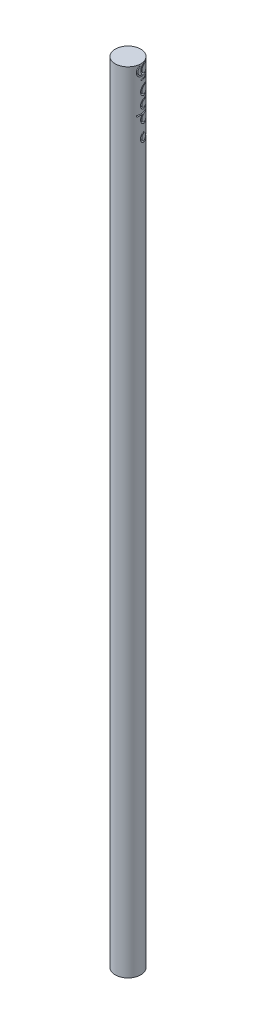
from build123d import *
from build123d.topology import SkipClean

# Parameters (mm, degrees)
SKETCH1_R           = 1
BOSS_EXTRUDE1_DEPTH = 61.8
CUT_EXTRUDE1_DEPTH  = 1


with BuildPart() as part:
    # Sketch1 → Boss-Extrude1 (new body)
    with BuildSketch(Plane(origin=(0, 0, 0), x_dir=(1, 0, 0), z_dir=(0, 1, 0))):
        Circle(SKETCH1_R)
    extrude(amount=BOSS_EXTRUDE1_DEPTH)

    # Sketch2 → Cut-Extrude1 (cut)
    # profile 1 of 6: a face of its own
    with SkipClean():  # the faces are left unmerged after this step: merging them gives an invalid solid
        with BuildSketch(Plane(origin=(1, 0, 0), x_dir=(0, 0, -1), z_dir=(1, 0, 0))):
            with BuildLine():
                Line((0.773397436, 61.013034188), (0.773397436, 60.918055556))
                Line((0.773397436, 60.918055556), (0.159640425, 60.918055556))
                add(Edge.make_bspline(
                    [(0.159640425, 60.918055556), (0.1465662, 60.918139328), (0.121329796, 60.918301029), (0.084838983, 60.919465489), (0.051133762, 60.921921027), (0.020060412, 60.924705557), (-0.008237035, 60.928711112), (-0.033843019, 60.933602537), (-0.05678211, 60.939116659), (-0.070910812, 60.943960868), (-0.077594151, 60.946252337)],
                    knots=[0, 0, 0, 0, 1.307562039, 2.523909702, 3.650326591, 4.686913197, 5.643429486, 6.506965704, 7.293745905, 8, 8, 8, 8], degree=3))
                add(Edge.make_bspline(
                    [(-0.077594151, 60.946252337), (-0.086281834, 60.949635422), (-0.103397445, 60.95630044), (-0.127654434, 60.968789133), (-0.150514313, 60.982751952), (-0.171715879, 60.998755843), (-0.191592708, 61.016395929), (-0.209797708, 61.035996131), (-0.226613422, 61.057207943), (-0.241707156, 61.080203982), (-0.254933259, 61.104751286), (-0.266639825, 61.130523377), (-0.276750372, 61.157445753), (-0.284339135, 61.185777371), (-0.290910135, 61.215087879), (-0.295187544, 61.245718111), (-0.298098493, 61.277490173), (-0.298367695, 61.299093889), (-0.298504274, 61.31005442)],
                    knots=[0, 0, 0, 0, 0.981884813, 1.934411902, 2.870642727, 3.801527012, 4.729816098, 5.667674509, 6.616731011, 7.579249157, 8.562291171, 9.552107921, 10.560574871, 11.588648803, 12.640348669, 13.724070705, 14.845319185, 16, 16, 16, 16], degree=3))
                add(Edge.make_bspline(
                    [(-0.298504274, 61.31005442), (-0.298245863, 61.326045916), (-0.297741117, 61.357281603), (-0.291839431, 61.402819467), (-0.283548887, 61.446011998), (-0.270868408, 61.486312593), (-0.255415135, 61.523565511), (-0.237814156, 61.557603578), (-0.21742875, 61.587866964), (-0.194305039, 61.61512324), (-0.166796954, 61.639718107), (-0.134382791, 61.662858889), (-0.096564724, 61.685132436), (-0.068808389, 61.698185828), (-0.054273504, 61.705021368)],
                    knots=[0, 0, 0, 0, 1.157931887, 2.261752077, 3.322178827, 4.340878186, 5.316509817, 6.24181319, 7.112369066, 7.954886437, 8.824930176, 9.778504873, 10.836691706, 12, 12, 12, 12], degree=3))
                Line((-0.054273504, 61.705021368), (-0.054273504, 61.610042735))
                add(Edge.make_bspline(
                    [(-0.054273504, 61.610042735), (-0.066400757, 61.602403924), (-0.090108043, 61.587470989), (-0.120803688, 61.559546568), (-0.147036253, 61.528943702), (-0.16817594, 61.494629608), (-0.184114376, 61.456461507), (-0.19547643, 61.414416438), (-0.202278873, 61.368152266), (-0.203098717, 61.335943187), (-0.203525641, 61.319170673)],
                    knots=[0, 0, 0, 0, 0.997731894, 1.950442991, 2.880492273, 3.800895997, 4.748200782, 5.754801363, 6.83083817, 8, 8, 8, 8], degree=3))
                add(Edge.make_bspline(
                    [(-0.203525641, 61.319170673), (-0.203095157, 61.302609777), (-0.202265228, 61.270682028), (-0.195442828, 61.224709357), (-0.184142908, 61.182717427), (-0.168262978, 61.145021644), (-0.148650157, 61.11219146), (-0.126950924, 61.083791421), (-0.102394777, 61.060771856), (-0.079784142, 61.045284855), (-0.059638006, 61.035658834), (-0.042295735, 61.029528859), (-0.022685441, 61.024547456), (-0.000872974, 61.020380692), (0.023172862, 61.016942345), (0.049507038, 61.014764331), (0.078069708, 61.013190192), (0.097873585, 61.013087392), (0.108122997, 61.013034188)],
                    knots=[0, 0, 0, 0, 1.570672572, 3.028099501, 4.397683431, 5.686589315, 6.895122698, 8.017723291, 9.066023084, 10.075791025, 10.603605416, 11.180458235, 11.81795017, 12.521450677, 13.286658401, 14.121327423, 15.027701111, 16, 16, 16, 16], degree=3))
                Line((0.108122997, 61.013034188), (0.148192107, 61.013034188))
                add(Edge.make_bspline(
                    [(0.148192107, 61.013034188), (0.136719229, 61.022674431), (0.113975277, 61.041785347), (0.084172115, 61.07478942), (0.058504166, 61.110838344), (0.037452817, 61.149870749), (0.020615815, 61.190930527), (0.008840206, 61.233572963), (0.001232331, 61.277415799), (0.00041369, 61.307125377), (0, 61.322138755)],
                    knots=[0, 0, 0, 0, 1.012485704, 2.007162095, 2.997754123, 3.998611389, 4.999708251, 5.992315798, 6.98544096, 8, 8, 8, 8], degree=3))
                add(Edge.make_bspline(
                    [(0, 61.322138755), (0.000155734, 61.330979246), (0.00046536, 61.34855561), (0.003174323, 61.374667641), (0.007104895, 61.400394345), (0.012874759, 61.425675722), (0.020280591, 61.450548253), (0.02953851, 61.474970833), (0.04000546, 61.499141212), (0.052334385, 61.522620024), (0.066051061, 61.545173485), (0.080909804, 61.566631271), (0.096832381, 61.586881753), (0.113977513, 61.605729384), (0.132314096, 61.623159773), (0.151669946, 61.639368944), (0.172197325, 61.654210359), (0.193904221, 61.667491671), (0.216261397, 61.679625464), (0.239375941, 61.690014192), (0.263101622, 61.698638172), (0.287141833, 61.706238551), (0.311934957, 61.711620557), (0.337187142, 61.715735954), (0.36305245, 61.718044958), (0.380475703, 61.718407379), (0.389242788, 61.718589744)],
                    knots=[0, 0, 0, 0, 1.028796061, 2.045417375, 3.052978994, 4.056772505, 5.061374657, 6.071351207, 7.095367434, 8.125609542, 9.155490328, 10.16637099, 11.162041966, 12.151987513, 13.129482149, 14.104793677, 15.088808581, 16.075021637, 17.065069715, 18.0481558, 19.021557435, 20.00254184, 20.980451754, 21.971763498, 22.979425854, 24, 24, 24, 24], degree=3))
                add(Edge.make_bspline(
                    [(0.389242788, 61.718589744), (0.398012814, 61.718432867), (0.415518898, 61.718119723), (0.441486565, 61.715411487), (0.467109459, 61.711556716), (0.492109575, 61.705423653), (0.516847826, 61.698146354), (0.540921458, 61.688707997), (0.564649062, 61.677833805), (0.587822563, 61.665405123), (0.610228762, 61.651492544), (0.631408757, 61.636178543), (0.65153872, 61.619783262), (0.670360465, 61.601976748), (0.68801507, 61.582864261), (0.704347612, 61.562390242), (0.719653306, 61.540782414), (0.733596229, 61.517966767), (0.745928075, 61.494297263), (0.757180437, 61.470374728), (0.766110997, 61.445882411), (0.773979885, 61.421276903), (0.779554338, 61.396124882), (0.783854873, 61.370734741), (0.786474919, 61.345019558), (0.78680197, 61.327798088), (0.786965812, 61.319170673)],
                    knots=[0, 0, 0, 0, 1.008914434, 2.013921196, 3.001938835, 3.98818112, 4.973517748, 5.967241793, 6.960633033, 7.975722852, 8.991170928, 9.993245185, 10.981396684, 11.976616977, 12.972235889, 13.973022409, 14.988340224, 16.01763096, 17.047082309, 18.058647952, 19.057085865, 20.044802253, 21.029198803, 22.0185208, 23.007341325, 24, 24, 24, 24], degree=3))
                add(Edge.make_bspline(
                    [(0.786965812, 61.319170673), (0.786561972, 61.304942217), (0.785766497, 61.276915308), (0.779331072, 61.235587423), (0.769300753, 61.195664739), (0.754719793, 61.156942746), (0.734987726, 61.119185088), (0.708662772, 61.082619007), (0.676264918, 61.046618516), (0.651170392, 61.024514031), (0.638137687, 61.013034188)],
                    knots=[0, 0, 0, 0, 0.967343326, 1.905452219, 2.838102277, 3.762990896, 4.713322225, 5.726933809, 6.819495538, 8, 8, 8, 8], degree=3))
                Line((0.638137687, 61.013034188), (0.773397436, 61.013034188))
            make_face()
            with BuildLine():
                add(Edge.make_bspline(
                    [(0.691987179, 61.311538462), (0.691515147, 61.325427037), (0.690580623, 61.352923473), (0.682602328, 61.393227243), (0.670100344, 61.432137021), (0.652215875, 61.468906955), (0.63041916, 61.503354842), (0.603997404, 61.533901342), (0.573909274, 61.56066907), (0.540141325, 61.583031674), (0.503877185, 61.601000477), (0.465701711, 61.614064268), (0.426054771, 61.622227065), (0.399033751, 61.62314757), (0.385426683, 61.623611111)],
                    knots=[0, 0, 0, 0, 1.026331696, 2.03191913, 3.02692423, 4.041490544, 5.047661868, 6.033509946, 7.018359977, 8.017132933, 9.01989117, 10.003339456, 10.994534818, 12, 12, 12, 12], degree=3))
                add(Edge.make_bspline(
                    [(0.385426683, 61.623611111), (0.375165846, 61.623391756), (0.35498578, 61.622960349), (0.325372106, 61.618809173), (0.297162708, 61.612107274), (0.270374741, 61.602582508), (0.244751554, 61.590858007), (0.220766907, 61.57575644), (0.197980726, 61.558376074), (0.176861302, 61.53843981), (0.157597372, 61.516505482), (0.140759036, 61.492729695), (0.126797952, 61.46724266), (0.114910879, 61.440451628), (0.106166214, 61.411789399), (0.099505523, 61.381685762), (0.095691929, 61.349938796), (0.0952195, 61.328296793), (0.094978632, 61.31726262)],
                    knots=[0, 0, 0, 0, 1.039892369, 2.045164194, 3.025377528, 3.974939947, 4.923826224, 5.876304068, 6.842270891, 7.825700405, 8.815919897, 9.798017152, 10.773083594, 11.758208475, 12.764450271, 13.80592145, 14.881349344, 16, 16, 16, 16], degree=3))
                add(Edge.make_bspline(
                    [(0.094978632, 61.31726262), (0.095210743, 61.306085484), (0.095664632, 61.284228712), (0.099566405, 61.252306072), (0.105862572, 61.222058074), (0.114801873, 61.19351247), (0.126208194, 61.166561414), (0.140642902, 61.141507906), (0.157081433, 61.117813854), (0.176256908, 61.096239107), (0.197385494, 61.076720527), (0.220392199, 61.059745791), (0.244833019, 61.045167181), (0.271019563, 61.033564083), (0.298605793, 61.023992893), (0.328056868, 61.017958838), (0.358939321, 61.0136312), (0.380110189, 61.013236217), (0.390938835, 61.013034188)],
                    knots=[0, 0, 0, 0, 1.121992135, 2.194043731, 3.223932285, 4.220423016, 5.193184374, 6.156086365, 7.118779155, 8.084057622, 9.048292205, 10.002025119, 10.950065319, 11.899697616, 12.87359713, 13.875731462, 14.913461982, 16, 16, 16, 16], degree=3))
                add(Edge.make_bspline(
                    [(0.390938835, 61.013034188), (0.405035187, 61.013439248), (0.432574504, 61.014230592), (0.4727025, 61.021698543), (0.510430181, 61.033739413), (0.545638161, 61.05062642), (0.577953629, 61.071787599), (0.606777185, 61.097275721), (0.632149319, 61.12665017), (0.653277049, 61.159830591), (0.670410726, 61.195576867), (0.6830955, 61.232964772), (0.690448099, 61.271888872), (0.691470296, 61.298222574), (0.691987179, 61.311538462)],
                    knots=[0, 0, 0, 0, 1.070930318, 2.092221514, 3.091405799, 4.074392322, 5.052047932, 6.019043127, 6.99061078, 7.993717296, 9.000730765, 9.998165278, 10.987753177, 12, 12, 12, 12], degree=3))
            make_face(mode=Mode.SUBTRACT)
        # profile 2 of 6: a face of its own
        with BuildSketch(Plane(origin=(1, 0, 0), x_dir=(0, 0, -1), z_dir=(1, 0, 0))):
            with BuildLine():
                Line((0.773397436, 60.728098291), (0.773397436, 60.633119658))
                Line((0.773397436, 60.633119658), (0.65955028, 60.633119658))
                add(Edge.make_bspline(
                    [(0.65955028, 60.633119658), (0.670151604, 60.626108662), (0.690426554, 60.612700185), (0.717224072, 60.590399869), (0.739510637, 60.567564501), (0.757068629, 60.543910092), (0.770325711, 60.519634386), (0.780117681, 60.495141051), (0.785809509, 60.469922699), (0.786579861, 60.4529419), (0.786965812, 60.444434428)],
                    knots=[0, 0, 0, 0, 1.280622107, 2.44917983, 3.507334186, 4.490567186, 5.408878616, 6.288712897, 7.142636019, 8, 8, 8, 8], degree=3))
                add(Edge.make_bspline(
                    [(0.786965812, 60.444434428), (0.786613873, 60.437832425), (0.785893401, 60.424317135), (0.780578028, 60.403795714), (0.772413751, 60.382565181), (0.764548364, 60.368864694), (0.760465077, 60.361752137)],
                    knots=[0, 0, 0, 0, 0.90119973, 1.844890732, 2.881183062, 4, 4, 4, 4], degree=3))
                Line((0.760465077, 60.361752137), (0.678206798, 60.413905582))
                add(Edge.make_bspline(
                    [(0.678206798, 60.413905582), (0.680244926, 60.418474262), (0.684113683, 60.427146492), (0.688692338, 60.439832754), (0.691388341, 60.451529253), (0.691796773, 60.458980996), (0.691987179, 60.462454928)],
                    knots=[0, 0, 0, 0, 1.180555205, 2.24091978, 3.179933427, 4, 4, 4, 4], degree=3))
                add(Edge.make_bspline(
                    [(0.691987179, 60.462454928), (0.691497847, 60.470153251), (0.690508666, 60.485715345), (0.682177989, 60.508530063), (0.669284361, 60.530768933), (0.654475901, 60.548205719), (0.640469657, 60.561810195), (0.628171808, 60.571523849), (0.614391561, 60.580440275), (0.59935371, 60.588958004), (0.582804605, 60.596719122), (0.564908683, 60.603962523), (0.545645478, 60.610511761), (0.532225048, 60.614246238), (0.525350561, 60.616159188)],
                    knots=[0, 0, 0, 0, 1.135927944, 2.296268816, 3.551388088, 4.924624343, 5.663947748, 6.437790805, 7.238014523, 8.089896346, 8.992356783, 9.939655789, 10.944608424, 12, 12, 12, 12], degree=3))
                add(Edge.make_bspline(
                    [(0.525350561, 60.616159188), (0.51921913, 60.617590174), (0.505638476, 60.620759698), (0.482854517, 60.623841425), (0.455935459, 60.626886255), (0.42480637, 60.629032138), (0.389544988, 60.631021212), (0.350097595, 60.63214307), (0.306423701, 60.633081401), (0.275890979, 60.633106519), (0.259919204, 60.633119658)],
                    knots=[0, 0, 0, 0, 0.566838948, 1.255505196, 2.06880316, 3.007127437, 4.065329342, 5.249902469, 6.561414163, 8, 8, 8, 8], degree=3))
                Line((0.259919204, 60.633119658), (0, 60.633119658))
                Line((0, 60.633119658), (0, 60.728098291))
                Line((0, 60.728098291), (0.773397436, 60.728098291))
            make_face()
        # profile 3 of 6: a face of its own
        with BuildSketch(Plane(origin=(1, 0, 0), x_dir=(0, 0, -1), z_dir=(1, 0, 0))):
            with BuildLine():
                add(Edge.make_bspline(
                    [(0.786965812, 59.879650775), (0.786657718, 59.865138768), (0.786053622, 59.836684268), (0.779565303, 59.79501889), (0.769726183, 59.755287929), (0.75587634, 59.717320953), (0.737704805, 59.681432025), (0.715730013, 59.647300716), (0.689803291, 59.614995409), (0.669736185, 59.595636871), (0.65955028, 59.58581063)],
                    knots=[0, 0, 0, 0, 1.054042676, 2.066720093, 3.05716247, 4.025731183, 4.997454851, 5.974904663, 6.97207755, 8, 8, 8, 8], degree=3))
                add(Edge.make_bspline(
                    [(0.65955028, 59.58581063), (0.649809385, 59.57734942), (0.630516107, 59.560590748), (0.5992331, 59.539101829), (0.566835974, 59.520589595), (0.532894521, 59.50575389), (0.497705037, 59.494056276), (0.461146571, 59.485751172), (0.423299862, 59.480811194), (0.39759632, 59.480145059), (0.384578659, 59.479807692)],
                    knots=[0, 0, 0, 0, 1.025258237, 2.030674902, 3.01204498, 3.988269485, 4.97094183, 5.956517959, 6.965070386, 8, 8, 8, 8], degree=3))
                add(Edge.make_bspline(
                    [(0.384578659, 59.479807692), (0.371485546, 59.48010443), (0.345612945, 59.480690798), (0.30750709, 59.486237558), (0.270557702, 59.494864814), (0.234919482, 59.507211586), (0.200483469, 59.523043674), (0.167400163, 59.542363028), (0.135603937, 59.565305058), (0.105366154, 59.591311421), (0.07749361, 59.620051833), (0.05321559, 59.651237499), (0.032328167, 59.684278175), (0.015737745, 59.7196249), (0.002364709, 59.756774525), (-0.006856859, 59.795963344), (-0.012482266, 59.837156397), (-0.013201247, 59.865286732), (-0.013568376, 59.879650775)],
                    knots=[0, 0, 0, 0, 0.998669827, 1.973418153, 2.932281609, 3.89081133, 4.846438734, 5.82045571, 6.809776312, 7.834649874, 8.860672198, 9.859676908, 10.845817165, 11.837296335, 12.833502054, 13.853824644, 14.904110009, 16, 16, 16, 16], degree=3))
                add(Edge.make_bspline(
                    [(-0.013568376, 59.879650775), (-0.013198209, 59.894084501), (-0.012473219, 59.922353684), (-0.006898704, 59.963701846), (0.002463238, 60.003055662), (0.01557219, 60.040381013), (0.032464435, 60.075727595), (0.053134319, 60.108890275), (0.077505904, 60.14009065), (0.105362822, 60.168840072), (0.135604795, 60.19484402), (0.16739994, 60.217786674), (0.200483527, 60.237105865), (0.234919466, 60.252937995), (0.270557706, 60.265284756), (0.307507089, 60.273912015), (0.345612945, 60.279458775), (0.371485547, 60.280045143), (0.384578659, 60.28034188)],
                    knots=[0, 0, 0, 0, 1.099861214, 2.154133753, 3.1731438, 4.178222029, 5.163564916, 6.153006591, 7.15072618, 8.175428628, 9.198983792, 10.187031731, 11.15979573, 12.114193814, 13.071490482, 14.029120454, 15.002614863, 16, 16, 16, 16], degree=3))
                add(Edge.make_bspline(
                    [(0.384578659, 60.28034188), (0.397525567, 60.280002213), (0.42315822, 60.279329729), (0.460933783, 60.274394718), (0.497430375, 60.266122012), (0.532484031, 60.254410375), (0.566276746, 60.239437925), (0.598753921, 60.221185821), (0.62989547, 60.199477701), (0.649163813, 60.182785682), (0.658914263, 60.174338942)],
                    knots=[0, 0, 0, 0, 1.031353054, 2.041901799, 3.029428768, 4.008703097, 4.981709435, 5.96992636, 6.972712378, 8, 8, 8, 8], degree=3))
                add(Edge.make_bspline(
                    [(0.658914263, 60.174338942), (0.669186786, 60.164526702), (0.689389512, 60.145229206), (0.715265079, 60.112774773), (0.737536145, 60.078790284), (0.755698534, 60.04266986), (0.769701053, 60.004597314), (0.779611226, 59.964571065), (0.786024923, 59.922754033), (0.786649057, 59.894161715), (0.786965812, 59.879650775)],
                    knots=[0, 0, 0, 0, 1.027951202, 2.021646915, 2.998468564, 3.9668038, 4.943370589, 5.93035926, 6.949632805, 8, 8, 8, 8], degree=3))
            make_face()
            with BuildLine():
                add(Edge.make_bspline(
                    [(0.691987179, 59.880074786), (0.69169549, 59.890336862), (0.69111964, 59.9105961), (0.68674021, 59.94041695), (0.679800481, 59.969124429), (0.669944737, 59.996776666), (0.657203121, 60.02326671), (0.641641464, 60.048623709), (0.623176884, 60.072779537), (0.602176381, 60.095548625), (0.579366152, 60.116690315), (0.554838188, 60.134958399), (0.529296147, 60.150520772), (0.502607447, 60.163471558), (0.474519335, 60.173120562), (0.445345217, 60.180127404), (0.415026922, 60.184502994), (0.394416321, 60.18507339), (0.383942642, 60.185363248)],
                    knots=[0, 0, 0, 0, 1.021589593, 2.016807015, 2.994807536, 3.958602519, 4.934347097, 5.916793557, 6.916107818, 7.957073844, 8.998039869, 10.008589932, 10.997041759, 11.972786337, 12.956492182, 13.948170289, 14.957322718, 16, 16, 16, 16], degree=3))
                add(Edge.make_bspline(
                    [(0.383942642, 60.185363248), (0.370409883, 60.184878657), (0.343549888, 60.183916835), (0.304003889, 60.17605566), (0.265967247, 60.162997883), (0.229897931, 60.144992082), (0.19646744, 60.122817397), (0.166406585, 60.09688865), (0.140874633, 60.066847368), (0.119401831, 60.033716514), (0.10249202, 59.997965594), (0.090365437, 59.960193989), (0.082588555, 59.920745619), (0.08180646, 59.893750379), (0.081410256, 59.880074786)],
                    knots=[0, 0, 0, 0, 1.016977094, 2.018509362, 3.018404954, 4.033172147, 5.041280572, 6.028085189, 7.007940189, 7.995502847, 8.989109012, 9.972200833, 10.97273166, 12, 12, 12, 12], degree=3))
                add(Edge.make_bspline(
                    [(0.081410256, 59.880074786), (0.081804165, 59.866398407), (0.08258173, 59.839401615), (0.090404837, 59.799898357), (0.102439289, 59.762023232), (0.11942093, 59.72623514), (0.140793471, 59.693089198), (0.166552038, 59.663262432), (0.196388415, 59.63711039), (0.229853604, 59.614913748), (0.266023321, 59.597198071), (0.303996881, 59.584078886), (0.343551673, 59.576236564), (0.370410481, 59.575272198), (0.383942642, 59.574786325)],
                    knots=[0, 0, 0, 0, 1.027082318, 2.027431966, 3.015401697, 4.008827937, 4.996211763, 5.971861488, 6.96198607, 7.969911943, 8.982141629, 9.981856156, 10.983207064, 12, 12, 12, 12], degree=3))
                add(Edge.make_bspline(
                    [(0.383942642, 59.574786325), (0.394417157, 59.575074026), (0.415029404, 59.575640178), (0.445335729, 59.580046637), (0.474577037, 59.586944634), (0.502494254, 59.597016171), (0.529426496, 59.609522479), (0.554761489, 59.625463424), (0.579381745, 59.643646419), (0.602162633, 59.664826903), (0.623253615, 59.687593428), (0.641574202, 59.711930728), (0.657212008, 59.737299504), (0.669946307, 59.76379792), (0.679762546, 59.79138758), (0.686770441, 59.820007902), (0.691103672, 59.849696692), (0.691690793, 59.86988399), (0.691987179, 59.880074786)],
                    knots=[0, 0, 0, 0, 1.043020522, 2.052505155, 3.044509714, 4.030878336, 5.003918577, 5.996372628, 7.007255355, 8.048564058, 9.08987276, 10.095126797, 11.077896669, 12.053962454, 13.01807471, 13.98956039, 14.985105429, 16, 16, 16, 16], degree=3))
            make_face(mode=Mode.SUBTRACT)
        # profile 4 of 6: a face of its own
        with BuildSketch(Plane(origin=(1, 0, 0), x_dir=(0, 0, -1), z_dir=(1, 0, 0))):
            with BuildLine():
                Line((0.773397436, 59.303418803), (0.773397436, 59.208440171))
                Line((0.773397436, 59.208440171), (0.414683494, 59.208440171))
                add(Edge.make_bspline(
                    [(0.414683494, 59.208440171), (0.404153758, 59.208397262), (0.384010866, 59.208315178), (0.355026083, 59.207758513), (0.328592934, 59.206449175), (0.304696149, 59.204812137), (0.283339772, 59.20270692), (0.264598395, 59.20020219), (0.248259487, 59.197402619), (0.238418996, 59.194662227), (0.233842481, 59.193387754)],
                    knots=[0, 0, 0, 0, 1.388932606, 2.656963016, 3.823490214, 4.879454478, 5.816252168, 6.653371382, 7.373723809, 8, 8, 8, 8], degree=3))
                add(Edge.make_bspline(
                    [(0.233842481, 59.193387754), (0.228090343, 59.191343205), (0.216705653, 59.187296614), (0.200259221, 59.179956969), (0.185027562, 59.170876247), (0.170418114, 59.160942753), (0.156883002, 59.149472518), (0.144333823, 59.136633257), (0.132624186, 59.122652864), (0.118501428, 59.102174356), (0.103555633, 59.074179981), (0.090479932, 59.03750823), (0.082780286, 58.997673314), (0.081875373, 58.970108991), (0.081410256, 58.955941173)],
                    knots=[0, 0, 0, 0, 0.725930277, 1.436768641, 2.137297926, 2.832005607, 3.535753883, 4.242956221, 4.964984144, 5.701683124, 7.198126434, 8.723945959, 10.316137162, 12, 12, 12, 12], degree=3))
                add(Edge.make_bspline(
                    [(0.081410256, 58.955941173), (0.081873636, 58.941771559), (0.082767918, 58.914425446), (0.090363682, 58.875006746), (0.102755544, 58.838906961), (0.120295761, 58.806547586), (0.141679564, 58.778131762), (0.166781694, 58.754454594), (0.19479663, 58.734918438), (0.215698559, 58.726388467), (0.22621027, 58.722098691)],
                    knots=[0, 0, 0, 0, 1.157091467, 2.233085092, 3.266839029, 4.264239195, 5.228693433, 6.160074799, 7.074690074, 8, 8, 8, 8], degree=3))
                add(Edge.make_bspline(
                    [(0.22621027, 58.722098691), (0.230433323, 58.720829498), (0.239769461, 58.718023621), (0.255609946, 58.715030498), (0.274481925, 58.712222645), (0.29658359, 58.710350678), (0.321720038, 58.708214188), (0.350021261, 58.707476452), (0.381320441, 58.706422928), (0.403233858, 58.706414605), (0.414683494, 58.706410256)],
                    knots=[0, 0, 0, 0, 0.557560243, 1.232629526, 2.036798082, 2.970922211, 4.03790722, 5.227863888, 6.551574656, 8, 8, 8, 8], degree=3))
                Line((0.414683494, 58.706410256), (0.773397436, 58.706410256))
                Line((0.773397436, 58.706410256), (0.773397436, 58.611431624))
                Line((0.773397436, 58.611431624), (0.396875, 58.611431624))
                add(Edge.make_bspline(
                    [(0.396875, 58.611431624), (0.384082117, 58.611565184), (0.359262174, 58.611824308), (0.323192934, 58.613489628), (0.289579577, 58.616346996), (0.258404375, 58.620684001), (0.229690914, 58.62578369), (0.203403108, 58.632362937), (0.179619573, 58.640216379), (0.157930958, 58.649084135), (0.138245594, 58.659531172), (0.119672945, 58.670725098), (0.102243929, 58.683287975), (0.08587288, 58.697108542), (0.070619176, 58.712124724), (0.056549316, 58.728436844), (0.043414307, 58.745717708), (0.031471145, 58.764268578), (0.020824984, 58.784108399), (0.011542913, 58.805137351), (0.003874939, 58.827508834), (-0.002395031, 58.850972237), (-0.007586833, 58.875723911), (-0.011066944, 58.901657129), (-0.013282241, 58.928836089), (-0.013471396, 58.947315033), (-0.013568376, 58.956789196)],
                    knots=[0, 0, 0, 0, 1.492959813, 2.896546261, 4.212934643, 5.4282803, 6.568701279, 7.614836728, 8.587629399, 9.489753423, 10.345563548, 11.185732697, 12.018869657, 12.849922188, 13.68387515, 14.5140269, 15.361852057, 16.215154979, 17.085973896, 17.987004002, 18.894652782, 19.842944701, 20.819888734, 21.843945232, 22.894589698, 24, 24, 24, 24], degree=3))
                add(Edge.make_bspline(
                    [(-0.013568376, 58.956789196), (-0.013465655, 58.96619219), (-0.013263799, 58.984669947), (-0.011104252, 59.011784824), (-0.007533686, 59.037774045), (-0.00243699, 59.062545213), (0.003924824, 59.086123186), (0.011485417, 59.108603468), (0.020883563, 59.129722831), (0.03146011, 59.149735008), (0.043423896, 59.168483349), (0.056537565, 59.186054277), (0.070781541, 59.20242423), (0.086096337, 59.217596819), (0.102671935, 59.231359076), (0.120374997, 59.243882498), (0.139030114, 59.255359883), (0.159006356, 59.265747513), (0.18095075, 59.274671305), (0.205231062, 59.282549915), (0.23211349, 59.288993847), (0.261575049, 59.294237879), (0.29347474, 59.298456529), (0.327997095, 59.301385433), (0.36505802, 59.303023078), (0.390654535, 59.303284051), (0.403871194, 59.303418803)],
                    knots=[0, 0, 0, 0, 1.083640291, 2.129454052, 3.13281866, 4.105697902, 5.042300162, 5.946461698, 6.836384745, 7.703652036, 8.553297018, 9.397182691, 10.228592656, 11.052265423, 11.879314572, 12.708807002, 13.549817954, 14.402308542, 15.300838682, 16.27712199, 17.341985831, 18.484375296, 19.725102775, 21.0496083, 22.476576903, 24, 24, 24, 24], degree=3))
                Line((0.403871194, 59.303418803), (0.773397436, 59.303418803))
            make_face()
        # profile 5 of 6: a face of its own
        with BuildSketch(Plane(origin=(1, 0, 0), x_dir=(0, 0, -1), z_dir=(1, 0, 0))):
            with BuildLine():
                Line((0.773397436, 58.394337607), (0.773397436, 58.299358974))
                Line((0.773397436, 58.299358974), (0.63029347, 58.299358974))
                add(Edge.make_bspline(
                    [(0.63029347, 58.299358974), (0.643273786, 58.289269791), (0.668498432, 58.269663483), (0.701236462, 58.235874103), (0.728642785, 58.200039849), (0.75023936, 58.161619656), (0.766605376, 58.1210764), (0.778581758, 58.078451159), (0.785679438, 58.033388143), (0.786531347, 58.002576116), (0.786965812, 57.986862313)],
                    knots=[0, 0, 0, 0, 1.082960489, 2.104516986, 3.092433479, 4.050182639, 5.001196938, 5.969027827, 6.964226023, 8, 8, 8, 8], degree=3))
                add(Edge.make_bspline(
                    [(0.786965812, 57.986862313), (0.786568732, 57.973136757), (0.785783882, 57.946007474), (0.780470125, 57.906074069), (0.771363108, 57.867618655), (0.758239498, 57.830858791), (0.742015106, 57.795400674), (0.721538764, 57.76176923), (0.697830226, 57.729440607), (0.670545742, 57.699227854), (0.641024814, 57.671311631), (0.609268069, 57.647167667), (0.576319859, 57.626342115), (0.541669393, 57.609508478), (0.50558953, 57.596322144), (0.467934502, 57.586943896), (0.42884392, 57.581362657), (0.402263811, 57.580613825), (0.388818777, 57.580235043)],
                    knots=[0, 0, 0, 0, 1.041296284, 2.058176809, 3.050446431, 4.034000596, 5.01514041, 6.003636468, 7.015969324, 8.052561599, 9.08815499, 10.094063707, 11.074456064, 12.040834395, 13.011057502, 13.983766392, 14.980127149, 16, 16, 16, 16], degree=3))
                add(Edge.make_bspline(
                    [(0.388818777, 57.580235043), (0.375089198, 57.580603546), (0.348012487, 57.581330289), (0.30826457, 57.587027994), (0.269952532, 57.595983097), (0.23344098, 57.609406094), (0.198201654, 57.625840379), (0.164830101, 57.646403208), (0.133008182, 57.67053009), (0.103272691, 57.698146328), (0.075872834, 57.72809435), (0.051925134, 57.760115712), (0.031727205, 57.793732644), (0.015091276, 57.82878445), (0.002269396, 57.865393593), (-0.006807447, 57.903540331), (-0.012454394, 57.943232932), (-0.013194201, 57.970236531), (-0.013568376, 57.983894231)],
                    knots=[0, 0, 0, 0, 1.038787011, 2.048637893, 3.033314735, 4.011256821, 4.987456671, 5.971770257, 6.972013799, 8.005388554, 9.039095487, 10.040396776, 11.026510796, 12.002710647, 12.972028308, 13.95670515, 14.966556032, 16, 16, 16, 16], degree=3))
                add(Edge.make_bspline(
                    [(-0.013568376, 57.983894231), (-0.013188522, 57.999336313), (-0.012441609, 58.029700275), (-0.004491474, 58.074132285), (0.007040487, 58.11684249), (0.024426836, 58.157379705), (0.045986741, 58.196234021), (0.072945555, 58.23278923), (0.104016357, 58.267861022), (0.127946714, 58.288729437), (0.140135884, 58.299358974)],
                    knots=[0, 0, 0, 0, 1.019281043, 2.00422519, 2.974076634, 3.936751752, 4.91100001, 5.903882226, 6.932321223, 8, 8, 8, 8], degree=3))
                Line((0.140135884, 58.299358974), (-0.284935897, 58.299358974))
                Line((-0.284935897, 58.299358974), (-0.284935897, 58.394337607))
                Line((-0.284935897, 58.394337607), (0.773397436, 58.394337607))
            make_face()
            with BuildLine():
                add(Edge.make_bspline(
                    [(0.691987179, 57.987710337), (0.691793289, 57.998468775), (0.691411569, 58.019649368), (0.686887853, 58.050697538), (0.68029967, 58.08059413), (0.670424165, 58.109021367), (0.658014066, 58.136210566), (0.643019366, 58.162208902), (0.624766369, 58.186579156), (0.604317415, 58.209610062), (0.581897963, 58.230650544), (0.557751873, 58.249067192), (0.53221164, 58.26456354), (0.5054101, 58.277412095), (0.477154811, 58.287192961), (0.447601993, 58.294134094), (0.416720577, 58.298497623), (0.395688158, 58.299068793), (0.385002671, 58.299358974)],
                    knots=[0, 0, 0, 0, 1.056783697, 2.080534709, 3.078213817, 4.062450963, 5.032388505, 6.013014931, 7.006476528, 8.020136409, 9.037574406, 10.02408906, 10.99988041, 11.969394914, 12.94050107, 13.932990591, 14.949859205, 16, 16, 16, 16], degree=3))
                add(Edge.make_bspline(
                    [(0.385002671, 58.299358974), (0.37097793, 58.298871659), (0.343502274, 58.297916967), (0.303298452, 58.290340093), (0.265396158, 58.277530278), (0.229815681, 58.259924729), (0.197258218, 58.237516647), (0.167870902, 58.210814102), (0.142315062, 58.179513446), (0.120703887, 58.144433298), (0.103173416, 58.106805961), (0.090619255, 58.067562342), (0.082886974, 58.027235039), (0.081905161, 57.999969898), (0.081410256, 57.986226295)],
                    knots=[0, 0, 0, 0, 1.037446521, 2.0324456, 3.014856775, 3.990198243, 4.96070402, 5.930645943, 6.919052903, 7.940784962, 8.972706292, 9.9832942, 10.983434506, 12, 12, 12, 12], degree=3))
                add(Edge.make_bspline(
                    [(0.081410256, 57.986226295), (0.081880879, 57.972759533), (0.08281498, 57.94603043), (0.090900042, 57.906673014), (0.103251017, 57.86842496), (0.121259865, 57.832083602), (0.143333766, 57.797972283), (0.169798798, 57.767149139), (0.200560422, 57.740269644), (0.234604439, 57.717081416), (0.271271259, 57.69856289), (0.309266698, 57.684992095), (0.348267955, 57.676903188), (0.374577928, 57.675777583), (0.387758747, 57.675213675)],
                    knots=[0, 0, 0, 0, 1.000942316, 1.986690553, 2.977613063, 3.984008645, 4.994597959, 5.993715906, 6.995776077, 8.025307715, 9.050480445, 10.043228463, 11.019692995, 12, 12, 12, 12], degree=3))
                add(Edge.make_bspline(
                    [(0.387758747, 57.675213675), (0.401018808, 57.675655136), (0.42743562, 57.676534617), (0.466383792, 57.685143175), (0.504370229, 57.698196063), (0.540709795, 57.71675938), (0.574607338, 57.739531165), (0.604796149, 57.766607172), (0.631139996, 57.79705502), (0.652920114, 57.831123743), (0.67024107, 57.867695532), (0.682906173, 57.906192683), (0.690518159, 57.946422655), (0.691493199, 57.973826715), (0.691987179, 57.987710337)],
                    knots=[0, 0, 0, 0, 0.983883291, 1.96010114, 2.949781603, 3.961842304, 4.982704228, 5.97556912, 6.965945748, 7.965066277, 8.970293822, 9.964878779, 10.968953791, 12, 12, 12, 12], degree=3))
            make_face(mode=Mode.SUBTRACT)
        # profile 6 of 6: a face of its own
        with BuildSketch(Plane(origin=(1, 0, 0), x_dir=(0, 0, -1), z_dir=(1, 0, 0))):
            with BuildLine():
                Line((0.814102564, 56.915384615), (0.814102564, 57.010363248))
                add(Edge.make_bspline(
                    [(0.814102564, 57.010363248), (0.824756196, 57.007790122), (0.845583175, 57.002759871), (0.875339657, 56.992267986), (0.903498436, 56.980838211), (0.929532249, 56.96711341), (0.953964298, 56.952142906), (0.976240438, 56.934991035), (0.996927215, 56.916449119), (1.015285742, 56.895940146), (1.03190996, 56.874432194), (1.046084085, 56.851622202), (1.05827734, 56.827969089), (1.068322506, 56.803308975), (1.075889747, 56.777568442), (1.08138002, 56.750980199), (1.084945428, 56.723474569), (1.085293397, 56.704803274), (1.085470085, 56.695322516)],
                    knots=[0, 0, 0, 0, 1.162005537, 2.271625781, 3.343758855, 4.383309926, 5.390229558, 6.379919256, 7.361854164, 8.333198761, 9.295911338, 10.242430842, 11.177959212, 12.116337295, 13.062827104, 14.020064771, 14.994644689, 16, 16, 16, 16], degree=3))
                add(Edge.make_bspline(
                    [(1.085470085, 56.695322516), (1.085053033, 56.681508925), (1.084228024, 56.654183057), (1.076694373, 56.614038041), (1.064772964, 56.575325169), (1.048301146, 56.538468182), (1.027984982, 56.504233085), (1.003805169, 56.473772381), (0.976228237, 56.44749895), (0.945768629, 56.425457079), (0.913215653, 56.408198686), (0.879711796, 56.395472569), (0.845336533, 56.38772506), (0.822126594, 56.386720987), (0.810498464, 56.386217949)],
                    knots=[0, 0, 0, 0, 1.083050992, 2.142477498, 3.193116406, 4.255571735, 5.30263384, 6.308962982, 7.297363603, 8.282367274, 9.249857812, 10.179914175, 11.08814088, 12, 12, 12, 12], degree=3))
                add(Edge.make_bspline(
                    [(0.810498464, 56.386217949), (0.799308314, 56.386569796), (0.777410928, 56.387258308), (0.745442761, 56.393104452), (0.715313039, 56.402942798), (0.686894925, 56.416571036), (0.660368605, 56.43421241), (0.635674395, 56.455582487), (0.612702769, 56.480832101), (0.599543309, 56.499966447), (0.592768429, 56.509817374)],
                    knots=[0, 0, 0, 0, 1.024540389, 2.004866551, 2.965041327, 3.920577974, 4.882998113, 5.874504559, 6.905732034, 8, 8, 8, 8], degree=3))
                add(Edge.make_bspline(
                    [(0.592768429, 56.509817374), (0.587332173, 56.498559201), (0.576561376, 56.476253503), (0.555438326, 56.445848938), (0.531049383, 56.418248248), (0.512016723, 56.402855933), (0.502453926, 56.395122196)],
                    knots=[0, 0, 0, 0, 1.015518401, 2.012035669, 3.001164323, 4, 4, 4, 4], degree=3))
                add(Edge.make_bspline(
                    [(0.502453926, 56.395122196), (0.495482444, 56.390027621), (0.481653644, 56.3799219), (0.459406774, 56.367483345), (0.43698697, 56.356070132), (0.413512716, 56.347670338), (0.389738044, 56.340421648), (0.365153846, 56.335652251), (0.33999369, 56.33259049), (0.322964591, 56.332160556), (0.314404714, 56.331944444)],
                    knots=[0, 0, 0, 0, 1.02516404, 2.033540309, 3.025129118, 4.011046665, 4.991655828, 5.976607087, 6.982917762, 8, 8, 8, 8], degree=3))
                add(Edge.make_bspline(
                    [(0.314404714, 56.331944444), (0.299585697, 56.332488266), (0.270017402, 56.33357335), (0.226322159, 56.34323285), (0.183683197, 56.358294065), (0.142732288, 56.379308292), (0.104497251, 56.405308411), (0.070442495, 56.436412225), (0.040972775, 56.471863605), (0.016429527, 56.511430528), (-0.003204013, 56.554279326), (-0.016827546, 56.600113921), (-0.025701484, 56.648267826), (-0.026653001, 56.681290071), (-0.027136752, 56.698078592)],
                    knots=[0, 0, 0, 0, 0.95570045, 1.906903359, 2.87519758, 3.868912786, 4.869932978, 5.851730567, 6.836639976, 7.83677598, 8.849487602, 9.869908895, 10.917060885, 12, 12, 12, 12], degree=3))
                add(Edge.make_bspline(
                    [(-0.027136752, 56.698078592), (-0.026874221, 56.709393476), (-0.026357647, 56.731657394), (-0.022826261, 56.764388166), (-0.016376473, 56.79563068), (-0.007697141, 56.825427177), (0.003307029, 56.853804129), (0.01701054, 56.880674942), (0.033130923, 56.906204933), (0.05185846, 56.930153188), (0.072807818, 56.95251685), (0.096350899, 56.972701602), (0.122052495, 56.991043968), (0.150211134, 57.007052814), (0.180462914, 57.021457321), (0.213195198, 57.033304896), (0.248115366, 57.043732675), (0.272450302, 57.048580889), (0.284935897, 57.051068376)],
                    knots=[0, 0, 0, 0, 1.048658725, 2.063410685, 3.046034179, 4.001477787, 4.936774919, 5.862367409, 6.792675028, 7.730719943, 8.675894397, 9.627829632, 10.600096036, 11.597688215, 12.626045268, 13.701542398, 14.82072376, 16, 16, 16, 16], degree=3))
                Line((0.284935897, 57.051068376), (0.284935897, 56.956089744))
                add(Edge.make_bspline(
                    [(0.284935897, 56.956089744), (0.276787029, 56.953615272), (0.260936772, 56.94880221), (0.238125061, 56.940609411), (0.217212983, 56.931275433), (0.198047134, 56.921262221), (0.180438765, 56.910745882), (0.164853485, 56.89897875), (0.150606746, 56.886832365), (0.142580161, 56.877676465), (0.138651843, 56.873195446)],
                    knots=[0, 0, 0, 0, 1.198163088, 2.33053128, 3.407730985, 4.417276592, 5.372219308, 6.28897303, 7.162600585, 8, 8, 8, 8], degree=3))
                add(Edge.make_bspline(
                    [(0.138651843, 56.873195446), (0.134083371, 56.867269815), (0.124960528, 56.855436843), (0.113318369, 56.836154544), (0.10323063, 56.8158754), (0.095524846, 56.794160011), (0.089000172, 56.771476973), (0.084730396, 56.74745965), (0.081800878, 56.722319935), (0.081542363, 56.705154444), (0.081410256, 56.696382545)],
                    knots=[0, 0, 0, 0, 0.946170439, 1.889420265, 2.845303464, 3.807233317, 4.801018734, 5.828864929, 6.890507805, 8, 8, 8, 8], degree=3))
                add(Edge.make_bspline(
                    [(0.081410256, 56.696382545), (0.081596192, 56.686478376), (0.081959772, 56.667111628), (0.085313086, 56.638854531), (0.090175496, 56.61196392), (0.097781251, 56.586714213), (0.106905611, 56.562761823), (0.118851073, 56.540641437), (0.13234154, 56.519702743), (0.148033548, 56.500559147), (0.164994911, 56.48330026), (0.182989405, 56.468386675), (0.201459084, 56.455469804), (0.220834809, 56.445086795), (0.240926518, 56.436873348), (0.261809416, 56.431285352), (0.283307656, 56.42739904), (0.297921446, 56.427082599), (0.305288462, 56.426923077)],
                    knots=[0, 0, 0, 0, 1.216990249, 2.379719373, 3.493992396, 4.571561497, 5.616923107, 6.638958652, 7.655775068, 8.674704564, 9.676001865, 10.625896028, 11.54399481, 12.441854662, 13.322657739, 14.20572845, 15.095482574, 16, 16, 16, 16], degree=3))
                add(Edge.make_bspline(
                    [(0.305288462, 56.426923077), (0.31514952, 56.427385803), (0.334822571, 56.428308952), (0.363765575, 56.435357145), (0.39165283, 56.446949608), (0.41800453, 56.463181033), (0.442439378, 56.482930122), (0.464155968, 56.506005702), (0.482255493, 56.53246438), (0.494714528, 56.556973165), (0.50301795, 56.578734616), (0.508840155, 56.597320624), (0.513494322, 56.618146634), (0.517996303, 56.640962632), (0.521770478, 56.665864846), (0.524931498, 56.69287571), (0.527456837, 56.722006092), (0.528585202, 56.74217219), (0.529166667, 56.752564103)],
                    knots=[0, 0, 0, 0, 1.070481957, 2.135637345, 3.216366529, 4.339485895, 5.485746587, 6.620975969, 7.768829582, 8.956804399, 9.598399438, 10.297751078, 11.070570279, 11.915248466, 12.824061284, 13.805856426, 14.869322739, 16, 16, 16, 16], degree=3))
                Line((0.529166667, 56.752564103), (0.637713675, 56.752564103))
                add(Edge.make_bspline(
                    [(0.637713675, 56.752564103), (0.637936835, 56.739471017), (0.638373949, 56.713824878), (0.643624162, 56.676356506), (0.65096852, 56.640484968), (0.661958375, 56.607029073), (0.675149337, 56.576634644), (0.69002311, 56.550120265), (0.706874427, 56.528114315), (0.725482132, 56.510561816), (0.745672161, 56.497678904), (0.766495171, 56.488009003), (0.788435643, 56.482340116), (0.803400472, 56.481579102), (0.810922476, 56.481196581)],
                    knots=[0, 0, 0, 0, 1.321708579, 2.588902423, 3.815526512, 5.016621128, 6.138757764, 7.158873101, 8.079948563, 8.928590313, 9.728601868, 10.489025425, 11.240515403, 12, 12, 12, 12], degree=3))
                add(Edge.make_bspline(
                    [(0.810922476, 56.481196581), (0.816449331, 56.481321877), (0.827444748, 56.481571146), (0.843508562, 56.484715299), (0.859082194, 56.489438912), (0.874094982, 56.495937034), (0.888459784, 56.504618804), (0.902194223, 56.515039819), (0.915528473, 56.527205111), (0.927824608, 56.541432618), (0.939423011, 56.556835411), (0.9494494, 56.573558422), (0.95794776, 56.591232804), (0.964969218, 56.609874809), (0.970247653, 56.629559118), (0.97403851, 56.650189345), (0.976408396, 56.67180591), (0.976749618, 56.686553545), (0.976923077, 56.694050481)],
                    knots=[0, 0, 0, 0, 0.884317272, 1.759307272, 2.611736065, 3.488921043, 4.37244062, 5.294096728, 6.247679003, 7.258495569, 8.302441962, 9.333537773, 10.376747089, 11.440883505, 12.520330301, 13.637364711, 14.798958396, 16, 16, 16, 16], degree=3))
                add(Edge.make_bspline(
                    [(0.976923077, 56.694050481), (0.976503172, 56.706101264), (0.975682999, 56.729639247), (0.968474051, 56.763565353), (0.957052216, 56.795071702), (0.943260383, 56.819073185), (0.929692915, 56.836826801), (0.918020822, 56.849756602), (0.90478706, 56.862222254), (0.88962864, 56.873734595), (0.8730668, 56.884983468), (0.855010324, 56.895861462), (0.835201779, 56.906019178), (0.82127184, 56.912202345), (0.814102564, 56.915384615)],
                    knots=[0, 0, 0, 0, 1.4727372, 2.876598283, 4.222346151, 5.558423782, 6.24313385, 6.953189256, 7.68715613, 8.463578749, 9.278833271, 10.135787152, 11.040551781, 12, 12, 12, 12], degree=3))
            make_face()
        extrude(amount=-CUT_EXTRUDE1_DEPTH, mode=Mode.SUBTRACT)


solid = part.part
